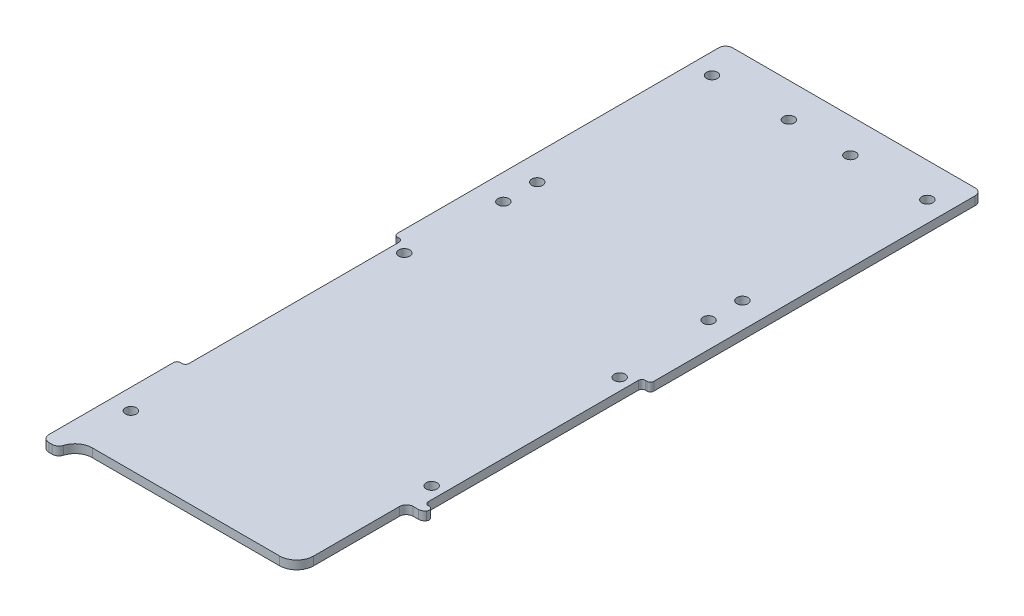
from build123d import *

# Parameters (mm, degrees)
SKETCH1_R               = 2.032
BOSS_EXTRUDE1_DEPTH     = 3.175
FILLET1_R               = 2.54
FILLET2_R               = 2.54
FILLET3_R               = 6.35
CUT_EXTRUDE1_DEPTH      = 136.673215063
FILLET4_R               = 6.35
FILLET5_R               = 2.54
SKETCH3_R               = 2.032
CUT_EXTRUDE2_DEPTH      = 136.673215063
CUT_EXTRUDE3_DEPTH      = 136.673215063
CUT_EXTRUDE3_DEPTH_BACK = 136.673215063
SKETCH4_W               = 3.175
SKETCH4_H               = 80.645
FILLET6_R               = 1.27


with BuildPart() as part:
    # Sketch1 → Boss-Extrude1 (new body)
    with BuildSketch(Plane(origin=(0, 0, 0), x_dir=(1, 0, 0), z_dir=(0, 1, 0))):
        Polygon((47.625, 127), (-47.625, 127), (-47.625, -127), (-41.275, -127), (-41.275, -120.65), (41.275, -120.65), (41.275, -127), (47.625, -127), align=None)
        with Locations((-39.999684148, -101.6)):
            Circle(SKETCH1_R, mode=Mode.SUBTRACT)
        with Locations((39.999684148, -69.85)):
            Circle(SKETCH1_R, mode=Mode.SUBTRACT)
        with Locations((-39.999684148, 0)):
            Circle(SKETCH1_R, mode=Mode.SUBTRACT)
        with Locations((-39.999684148, 114.3)):
            Circle(SKETCH1_R, mode=Mode.SUBTRACT)
        with Locations((-11.424684148, 114.3)):
            Circle(SKETCH1_R, mode=Mode.SUBTRACT)
        with Locations((39.999684148, 0)):
            Circle(SKETCH1_R, mode=Mode.SUBTRACT)
        with Locations((11.424684148, 114.3)):
            Circle(SKETCH1_R, mode=Mode.SUBTRACT)
        with Locations((39.999684148, 114.3)):
            Circle(SKETCH1_R, mode=Mode.SUBTRACT)
    extrude(amount=BOSS_EXTRUDE1_DEPTH)

    # Fillet1
    fillet1_edges = [part.edges().sort_by_distance(p)[0] for p in [
        (-47.625, 1.5875, -127),
        (47.625, 1.5875, -127),
        (47.625, 1.5875, 127),
        (-47.625, 1.5875, 127),
    ]]
    fillet(fillet1_edges, radius=FILLET1_R)

    # Fillet2
    fillet2_edges = [part.edges().sort_by_distance(p)[0] for p in [
        (41.275, 1.5875, 127),
        (-41.275, 1.5875, 127),
    ]]
    fillet(fillet2_edges, radius=FILLET2_R)

    # Fillet3
    fillet3_edges = [part.edges().sort_by_distance(p)[0] for p in [
        (41.275, 1.5875, 120.65),
        (-41.275, 1.5875, 120.65),
    ]]
    fillet(fillet3_edges, radius=FILLET3_R)

    # Sketch2 → Cut-Extrude1 (cut, through all)
    with BuildSketch(Plane.XZ):
        with BuildLine():
            Line((40.64508, 123.578690235), (40.64508, 79.88808))
            Line((40.64508, 79.88808), (47.625, 79.88808))
            Line((47.625, 79.88808), (47.625, 124.46))
            ThreePointArc((47.625, 124.46), (46.881051224, 126.256051224), (45.085, 127))
            Line((45.085, 127), (43.815, 127))
            ThreePointArc((43.815, 127), (42.297059666, 126.496530663), (41.380880287, 125.185714286))
            ThreePointArc((41.380880287, 125.185714286), (41.069166069, 124.356476684), (40.64508, 123.578690235))
        make_face()
    extrude(amount=-CUT_EXTRUDE1_DEPTH, mode=Mode.SUBTRACT)

    # Fillet4
    fillet4_edges = [part.edges().sort_by_distance(p)[0] for p in [
        (40.64508, 1.5875, 123.578690235),
    ]]
    fillet(fillet4_edges, radius=FILLET4_R)

    # Fillet5
    fillet5_edges = [part.edges().sort_by_distance(p)[0] for p in [
        (47.625, 1.5875, 79.88808),
        (40.64508, 1.5875, 79.88808),
    ]]
    fillet(fillet5_edges, radius=FILLET5_R)

    # Sketch3 → Cut-Extrude2 (cut, through all)
    with BuildSketch(Plane.XZ):
        with Locations((-38.10945291, -34.913768806)):
            Circle(SKETCH3_R)
        with Locations((-38.10945291, -47.490173279)):
            Circle(SKETCH3_R)
        with Locations((38.10945291, -47.490173279)):
            Circle(SKETCH3_R)
        with Locations((38.10945291, -34.913768806)):
            Circle(SKETCH3_R)
    extrude(amount=-CUT_EXTRUDE2_DEPTH, mode=Mode.SUBTRACT)

    # Sketch4 → Cut-Extrude3 (cut, two sides: drawn at the far end of the back side and taken through both)
    with BuildSketch(Plane(origin=(0, 3.175, 0), x_dir=(1, 0, 0), z_dir=(0, 1, 0)).offset(-CUT_EXTRUDE3_DEPTH_BACK)):
        with Locations((-46.0375, -36.5125)):
            Rectangle(SKETCH4_W, SKETCH4_H)
        with Locations((46.0375, -36.5125)):
            Rectangle(SKETCH4_W, SKETCH4_H)
    extrude(amount=CUT_EXTRUDE3_DEPTH + CUT_EXTRUDE3_DEPTH_BACK, mode=Mode.SUBTRACT)

    # Fillet6
    fillet6_edges = [part.edges().sort_by_distance(p)[0] for p in [
        (-44.45, 1.5875, -3.81),
        (-47.625, 1.5875, -3.81),
        (-47.625, 1.5875, 76.835),
        (-44.45, 1.5875, 76.835),
        (44.45, 1.5875, 76.835),
        (47.625, 1.5875, 76.835),
        (44.45, 1.5875, -3.81),
        (47.625, 1.5875, -3.81),
    ]]
    fillet(fillet6_edges, radius=FILLET6_R)


solid = part.part
